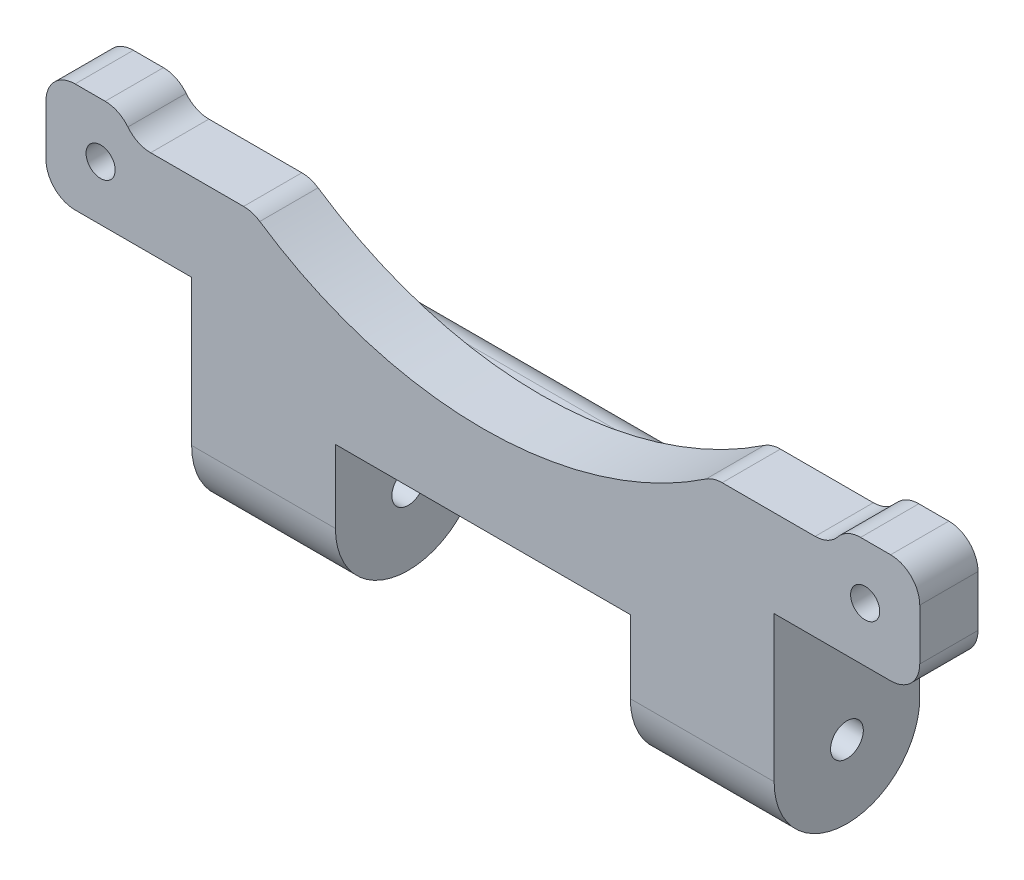
from build123d import *

# Parameters (mm, degrees)
SKETCH1_W           = 80
SKETCH1_H           = 20
BOSS_EXTRUDE1_DEPTH = 30
SKETCH2_W           = 40.5
SKETCH2_H           = 20
CUT_EXTRUDE1_DEPTH  = 20
SKETCH3_R           = 2.25
CUT_EXTRUDE2_DEPTH  = 88.749643874
FILLET1_R           = 10
SKETCH4_W           = 120
SKETCH4_H           = 20
BOSS_EXTRUDE2_DEPTH = 120
SKETCH7_R           = 2
SKETCH7_W           = 96
SKETCH7_H           = 96
CUT_EXTRUDE5_DEPTH  = 182.383571472
SKETCH8_W           = 120
SKETCH8_H           = 125
CUT_EXTRUDE6_DEPTH  = 12
FILLET2_R           = 4
FILLET3_R           = 4
SKETCH10_W          = 120
SKETCH10_H          = 105
CUT_EXTRUDE7_DEPTH  = 181.676506497
SKETCH11_R          = 55
CUT_EXTRUDE8_DEPTH  = 111.313190508
FILLET6_R           = 4
FILLET7_R           = 4


# Some blends are built 0.0001 mm under size
with BuildPart() as part:
    # Sketch1 → Boss-Extrude1 (new body)
    with BuildSketch(Plane(origin=(0, 0, 0), x_dir=(1, 0, 0), z_dir=(0, 1, 0))):
        with Locations((40, -10)):
            Rectangle(SKETCH1_W, SKETCH1_H)
    extrude(amount=BOSS_EXTRUDE1_DEPTH)

    # Sketch2 → Cut-Extrude1 (cut)
    with BuildSketch(Plane(origin=(0, 0, 0), x_dir=(-1, 0, 0), z_dir=(0, -1, 0))):
        with Locations((-40, -10)):
            Rectangle(SKETCH2_W, SKETCH2_H)
    extrude(amount=-CUT_EXTRUDE1_DEPTH, mode=Mode.SUBTRACT)

    # Sketch3 → Cut-Extrude2 (cut, through all)
    with BuildSketch(Plane.ZY):
        with Locations((10, 10)):
            Circle(SKETCH3_R)
    extrude(amount=-CUT_EXTRUDE2_DEPTH, mode=Mode.SUBTRACT)

    # Fillet1
    fillet1_edges = [part.edges().sort_by_distance(p)[0] for p in [
        (70.125, 0, 20),
        (70.125, 0, 0),
        (9.875, 0, 20),
        (9.875, 0, 0),
    ]]
    fillet(fillet1_edges, radius=FILLET1_R - 0.0001)  # a hair under: the kernel refuses the full size

    # Sketch4 → Boss-Extrude2 (add)
    with BuildSketch(Plane(origin=(0, 30, 0), x_dir=(1, 0, 0), z_dir=(0, 1, 0))):
        with Locations((40, -10)):
            Rectangle(SKETCH4_W, SKETCH4_H)
    extrude(amount=BOSS_EXTRUDE2_DEPTH)

    # Sketch7 → Cut-Extrude5 (cut, through all)
    with BuildSketch(Plane(origin=(0, 0, 0), x_dir=(-1, 0, 0), z_dir=(0, 0, -1))):
        with Locations((-92.5, 37.5)):
            Circle(SKETCH7_R)
        with Locations((12.5, 37.5)):
            Circle(SKETCH7_R)
        with Locations((12.5, 142.5)):
            Circle(SKETCH7_R)
        with Locations((-92.5, 142.5)):
            Circle(SKETCH7_R)
        with Locations((-40, 90)):
            Rectangle(SKETCH7_W, SKETCH7_H)
    extrude(amount=-CUT_EXTRUDE5_DEPTH, mode=Mode.SUBTRACT)

    # Sketch8 → Cut-Extrude6 (cut)
    with BuildSketch(Plane(origin=(0, 0, 0), x_dir=(-1, 0, 0), z_dir=(0, 0, -1))):
        with Locations((-40, 87.5)):
            Rectangle(SKETCH8_W, SKETCH8_H)
    extrude(amount=-CUT_EXTRUDE6_DEPTH, mode=Mode.SUBTRACT)

    # Fillet2
    fillet2_edges = [part.edges().sort_by_distance(p)[0] for p in [
        (40, 25, 12),
    ]]
    fillet(fillet2_edges, radius=FILLET2_R)

    # Fillet3
    fillet3_edges = [part.edges().sort_by_distance(p)[0] for p in [
        (40, 25, 0),
    ]]
    fillet(fillet3_edges, radius=FILLET3_R)

    # Sketch10 → Cut-Extrude7 (cut, through all)
    with BuildSketch(Plane(origin=(0, 0, 12), x_dir=(-1, 0, 0), z_dir=(0, 0, -1))):
        with Locations((-40, 97.5)):
            Rectangle(SKETCH10_W, SKETCH10_H)
    extrude(amount=-CUT_EXTRUDE7_DEPTH, mode=Mode.SUBTRACT)

    # Sketch11 → Cut-Extrude8 (cut, through all)
    with BuildSketch(Plane(origin=(0, 0, 12), x_dir=(-1, 0, 0), z_dir=(0, 0, -1))):
        with Locations((-40, 87)):
            Circle(SKETCH11_R)
    extrude(amount=-CUT_EXTRUDE8_DEPTH, mode=Mode.SUBTRACT)

    # Fillet6
    # the kernel refuses this fillet: 4 mm, written as the material it takes off along each edge
    with BuildSketch(Plane(origin=(-20, 30, 2), x_dir=(0, 1, 0), z_dir=(0, 0, 1)), Plane(origin=(100, 45, 2), x_dir=(0, -1, 0), z_dir=(0, 0, 1)), Plane(origin=(-20, 45, 2), x_dir=(1, 0, 0), z_dir=(0, 0, 1))) as fillet6_piece_1:
        with BuildLine():
            CenterArc((FILLET6_R, -FILLET6_R), FILLET6_R, 90, 90)
            Line((0, -FILLET6_R), (-FILLET6_R * 0.02, -FILLET6_R))
            Line((-FILLET6_R * 0.02, -FILLET6_R), (-FILLET6_R * 0.02, FILLET6_R * 0.02))
            Line((-FILLET6_R * 0.02, FILLET6_R * 0.02), (FILLET6_R, FILLET6_R * 0.02))
            Line((FILLET6_R, FILLET6_R * 0.02), (FILLET6_R, 0))
        make_face()
    extrude(amount=28, mode=Mode.SUBTRACT)
    with BuildSketch(Plane(origin=(100, 30, 30), x_dir=(-1, 0, 0), z_dir=(0, 0, -1))) as fillet6_piece_2:
        with BuildLine():
            CenterArc((FILLET6_R, FILLET6_R), FILLET6_R, 180, 90)
            Line((0, FILLET6_R), (-FILLET6_R * 0.02, FILLET6_R))
            Line((-FILLET6_R * 0.02, FILLET6_R), (-FILLET6_R * 0.02, -FILLET6_R * 0.02))
            Line((-FILLET6_R * 0.02, -FILLET6_R * 0.02), (FILLET6_R, -FILLET6_R * 0.02))
            Line((FILLET6_R, -FILLET6_R * 0.02), (FILLET6_R, 0))
        make_face()
    extrude(amount=28, mode=Mode.SUBTRACT)
    with BuildSketch(Plane(origin=(88, 45, 29.682458366), x_dir=(1, 0, 0), z_dir=(0, 0, -1))) as fillet6_piece_3:
        with BuildLine():
            CenterArc((3.872983346, 4), FILLET6_R, 194.477512186, 75.522487814)
            Line((0, 3), (-0.077459667, 2.98))
            ThreePointArc((-0.077459667, 2.98), (-0.08, 1.5), (-0.08, 0))
            Line((-0.08, 0), (0, -0.08))
            Line((0, -0.08), (3.872983346, -0.08))
            Line((3.872983346, -0.08), (3.872983346, 0))
        make_face()
    extrude(amount=27.364916731, mode=Mode.SUBTRACT)
    with BuildSketch(Plane(origin=(71.622776602, 42, 23.101442122), x_dir=(1, 0, 0), z_dir=(0, 0, -1))) as fillet6_piece_4:
        with BuildLine():
            CenterArc((1.240576849, 4), FILLET6_R, 236.151006115, 33.848993885)
            Line((-0.987447114, 0.677966102), (-1.032007593, 0.611525424))
            ThreePointArc((-1.032007593, 0.611525424), (-0.537159223, 0.275719676), (-0.045996766, -0.065454545))
            Line((-0.045996766, -0.065454545), (0, -0.08))
            Line((0, -0.08), (1.240576849, -0.08))
            Line((1.240576849, -0.08), (1.240576849, 0))
        make_face()
    extrude(amount=14.202884243, mode=Mode.SUBTRACT)
    with BuildSketch(Plane(origin=(8.377223398, 42, 23.101442122), x_dir=(0.8243940217834806, -0.5660163397355751, 0), z_dir=(0, 0, -1))) as fillet6_piece_5:
        with BuildLine():
            CenterArc((1.241341221, 3.999762854), FILLET6_R, 235.527102444, 33.848993885)
            Line((-1.022724138, 0.702186767), (-1.068005445, 0.636235245))
            Line((-1.068005445, 0.636235245), (-0.045281307, -0.065951522))
            Line((-0.045281307, -0.065951522), (0.000871117, -0.079995257))
            ThreePointArc((0.000871117, -0.079995257), (0.598892695, -0.076739245), (1.196914272, -0.079995257))
            Line((1.196914272, -0.079995257), (1.197785389, 0))
        make_face()
    extrude(amount=14.202884243, mode=Mode.SUBTRACT)
    with BuildSketch(Plane(origin=(-8, 45, 2.317541634), x_dir=(0, -1, 0), z_dir=(0, 0, 1))) as fillet6_piece_6:
        with BuildLine():
            CenterArc((4, -3.872983346), FILLET6_R, 104.477512186, 75.522487814)
            Line((0, -3.872983346), (-0.08, -3.872983346))
            Line((-0.08, -3.872983346), (-0.08, 0))
            Line((-0.08, 0), (0, 0.08))
            ThreePointArc((0, 0.08), (1.5, 0.08), (2.98, 0.077459667))
            Line((2.98, 0.077459667), (3, 0))
        make_face()
    extrude(amount=27.364916731, mode=Mode.SUBTRACT)

    # Fillet7
    fillet7_edges = [part.edges().sort_by_distance(p)[0] for p in [
        (88, 42, 16),
        (-8, 42, 16),
    ]]
    fillet(fillet7_edges, radius=FILLET7_R)


solid = part.part
